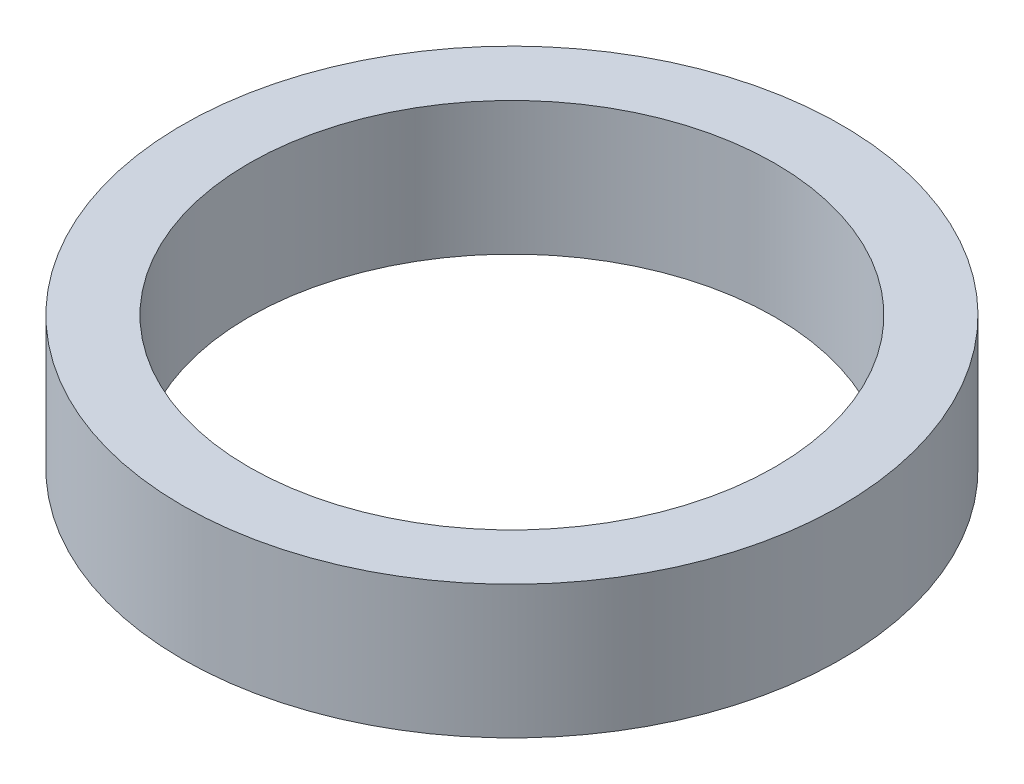
from build123d import *

# Parameters (mm, degrees)
SKETCH1_R           = 15.725
SKETCH1_R_2         = 12.55
BOSS_EXTRUDE1_DEPTH = 3.175


with BuildPart() as part:
    # Sketch1 → Boss-Extrude1 (new, symmetric)
    with BuildSketch(Plane(origin=(0, 0, 0), x_dir=(1, 0, 0), z_dir=(0, 1, 0))):
        Circle(SKETCH1_R)
        Circle(SKETCH1_R_2, mode=Mode.SUBTRACT)
    extrude(amount=BOSS_EXTRUDE1_DEPTH, both=True)


solid = part.part
